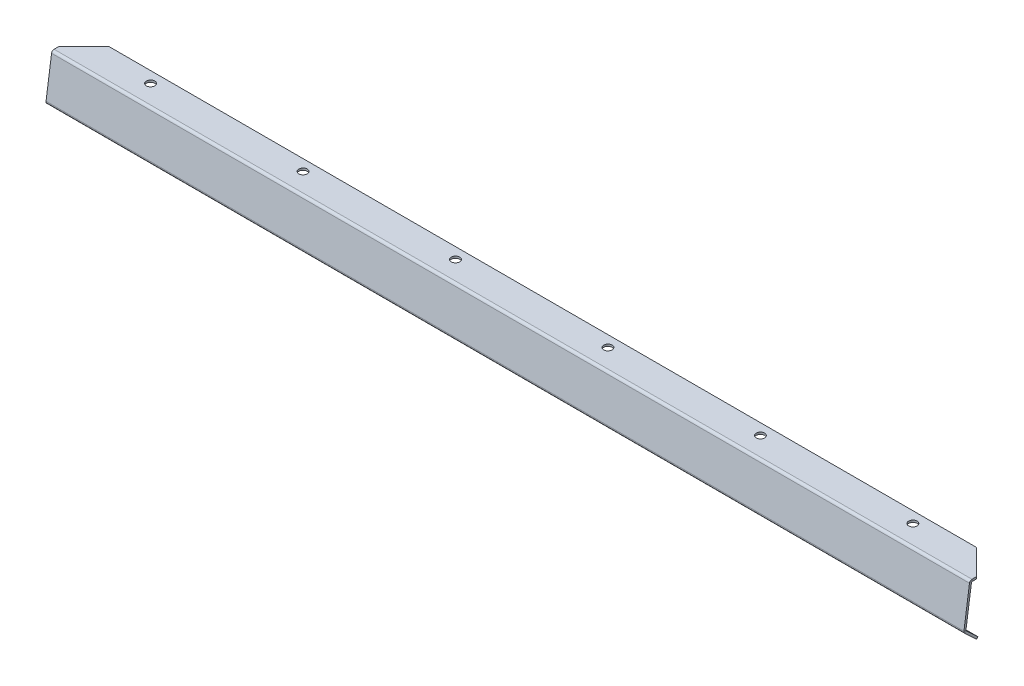
from build123d import *

# Parameters (mm, degrees)
BASE_FLANGE1_START = -229.4001
BASE_FLANGE1_DEPTH = 458.8002
SKETCH3_R          = 2.1082
CUT_EXTRUDE1_DEPTH = 232.388150944
CUT_EXTRUDE2_DEPTH = 1.016


# Read off the part's stored shape, not the designer's step: Base-Flange1
with BuildPart() as part:
    # Base-Flange1 outline → Base-Flange1 (new body)
    with BuildSketch(Plane(origin=(0, 0, 0), x_dir=(0, 0, -1), z_dir=(1, 0, 0)).offset(BASE_FLANGE1_START)):
        with BuildLine():
            ThreePointArc((-13.368341311, -20.466361656), (-13.309368584, -21.067196635), (-12.979624418, -21.572913195))
            Line((-12.979624418, -21.572913195), (-7.031153987, -27.148026486))
            Line((-7.031153987, -27.148026486), (-6.336374453, -26.406718588))
            Line((-6.336374453, -26.406718588), (-12.284844884, -20.831605297))
            ThreePointArc((-12.284844884, -20.831605297), (-12.350793717, -20.730461985), (-12.362588262, -20.610294989))
            Line((-12.362588262, -20.610294989), (-9.589648793, -1.234016667))
            ThreePointArc((-9.589648793, -1.234016667), (-9.504607996, -1.078094077), (-9.33821053, -1.016))
            Line((-9.33821053, -1.016), (5.5626, -1.016))
            Line((5.5626, -1.016), (5.5626, 0))
            Line((5.5626, 0), (-9.33821053, 0))
            ThreePointArc((-9.33821053, 0), (-10.17019786, -0.310470384), (-10.595401842, -1.090083333))
            Line((-10.595401842, -1.090083333), (-13.368341311, -20.466361656))
        make_face()
    extrude(amount=BASE_FLANGE1_DEPTH)

    # Sketch3 → Cut-Extrude1 (cut, through all)
    with BuildSketch(Plane(origin=(0, 0, 0), x_dir=(1, 0, 0), z_dir=(0, 1, 0))):
        with Locations(Location((-38.1, 0, 0), (0, 0, 270))):
            Circle(SKETCH3_R)
        with Locations(Location((-114.3, 0, 0), (0, 0, 270))):
            Circle(SKETCH3_R)
        with Locations(Location((-190.5, 0, 0), (0, 0, 270))):
            Circle(SKETCH3_R)
        with Locations(Location((190.5, 0, 0), (0, 0, 270))):
            Circle(SKETCH3_R)
        with Locations(Location((114.3, 0, 0), (0, 0, 270))):
            Circle(SKETCH3_R)
        with Locations(Location((38.1, 0, 0), (0, 0, 270))):
            Circle(SKETCH3_R)
    extrude(amount=-CUT_EXTRUDE1_DEPTH, mode=Mode.SUBTRACT)

    # Sketch4 → Cut-Extrude2 (cut)
    with BuildSketch(Plane(origin=(0, 0, 0), x_dir=(1, 0, 0), z_dir=(0, 1, 0))):
        Polygon((-215.810037107, 6.452662893), (-235.374711333, -13.112011333), (-235.374711333, 6.452662893), align=None)
        Polygon((235.374711333, 6.452662893), (215.810037107, 6.452662893), (235.374711333, -13.112011333), align=None)
    extrude(amount=-CUT_EXTRUDE2_DEPTH, mode=Mode.SUBTRACT)


solid = part.part
